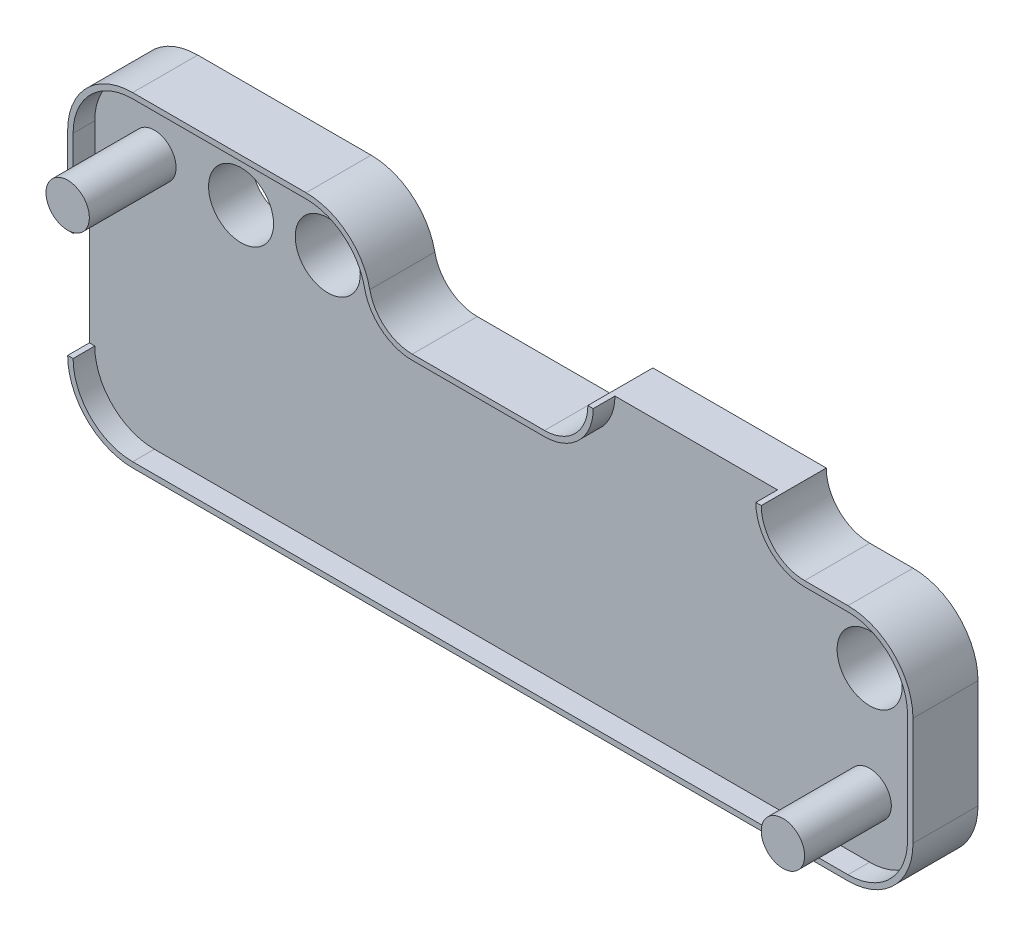
from build123d import *

# Parameters (mm, degrees)
BOSS_EXTRUDE1_DEPTH = 2
FILLET1_R           = 3
FILLET2_R           = 2
SKETCH3_R           = 1.5
CUT_EXTRUDE1_DEPTH  = 2
BOSS_EXTRUDE2_START = 1
BOSS_EXTRUDE2_DEPTH = 1
SKETCH3_5_R         = 1
BOSS_EXTRUDE3_DEPTH = 4


with BuildPart() as part:
    # Sketch1 → Boss-Extrude1 (new body)
    with BuildSketch(Plane.XY):
        Polygon((0, 0), (0, 15), (14, 15), (14, 11), (24, 11), (24, 13), (32, 13), (32, 11), (39, 11), (39, 0), align=None)
    extrude(amount=BOSS_EXTRUDE1_DEPTH)

    # Fillet1
    fillet1_edges = [part.edges().sort_by_distance(p)[0] for p in [
        (0, 0, 1),
        (0, 15, 1),
        (14, 15, 1),
        (39, 11, 1),
        (39, 0, 1),
    ]]
    fillet(fillet1_edges, radius=FILLET1_R)

    # Fillet2
    fillet2_edges = [part.edges().sort_by_distance(p)[0] for p in [
        (32, 11, 1),
        (24, 11, 1),
        (14, 11, 1),
    ]]
    fillet(fillet2_edges, radius=FILLET2_R - 0.0001)  # a hair under: the kernel refuses the full size

    # Sketch3 → Cut-Extrude1 (cut)
    with BuildSketch(Plane.XY.offset(2)):
        with Locations((7, 12)):
            Circle(SKETCH3_R)
        with Locations((11, 12)):
            Circle(SKETCH3_R)
        with Locations((36, 8)):
            Circle(SKETCH3_R)
    extrude(amount=-CUT_EXTRUDE1_DEPTH, mode=Mode.SUBTRACT)

    # Sketch3<4> → Boss-Extrude2 (add)
    with BuildSketch(Plane.XY.offset(2).offset(BOSS_EXTRUDE2_START)):
        with BuildLine():
            Line((0, 8), (0.25, 8))
            Line((0.25, 8), (0.25, 12))
            ThreePointArc((0.25, 12), (1.055456352, 13.944543648), (3, 14.75))
            Line((3, 14.75), (11, 14.75))
            ThreePointArc((11, 14.75), (12.739252713, 14.13014084), (13.694438717, 12.55))
            ThreePointArc((13.694438717, 12.55), (14.475954538, 11.257157494), (15.898979486, 10.75))
            Line((15.898979486, 10.75), (22, 10.75))
            ThreePointArc((22, 10.75), (23.590990258, 11.409009742), (24.25, 13))
            Line((24.25, 13), (24, 13))
            ThreePointArc((24, 13), (23.414213562, 11.585786438), (22, 11))
            Line((22, 11), (15.898979486, 11))
            ThreePointArc((15.898979486, 11), (14.634068421, 11.450806662), (13.939387691, 12.6))
            ThreePointArc((13.939387691, 12.6), (12.897366596, 14.323790008), (11, 15))
            Line((11, 15), (3, 15))
            ThreePointArc((3, 15), (0.878679656, 14.121320344), (0, 12))
            Line((0, 12), (0, 8))
        make_face()
        with BuildLine():
            ThreePointArc((3, 0.25), (1.055456352, 1.055456352), (0.25, 3))
            Line((0.25, 3), (0, 3))
            ThreePointArc((0, 3), (0.878679656, 0.878679656), (3, 0))
            Line((3, 0), (36, 0))
            ThreePointArc((36, 0), (38.121320344, 0.878679656), (39, 3))
            Line((39, 3), (39, 8))
            ThreePointArc((39, 8), (38.121320344, 10.121320344), (36, 11))
            Line((36, 11), (34, 11))
            ThreePointArc((34, 11), (32.585786438, 11.585786438), (32, 13))
            Line((32, 13), (31.75, 13))
            ThreePointArc((31.75, 13), (32.409009742, 11.409009742), (34, 10.75))
            Line((34, 10.75), (36, 10.75))
            ThreePointArc((36, 10.75), (37.944543648, 9.944543648), (38.75, 8))
            Line((38.75, 8), (38.75, 3))
            ThreePointArc((38.75, 3), (37.944543648, 1.055456352), (36, 0.25))
            Line((36, 0.25), (3, 0.25))
        make_face()
    extrude(amount=-BOSS_EXTRUDE2_DEPTH)

    # Sketch3<5> → Boss-Extrude3 (add)
    with BuildSketch(Plane.XY.offset(2)):
        with Locations(Location((3, 12, 0), (0, 0, 180))):
            Circle(SKETCH3_5_R)
        with Locations(Location((36, 3, 0), (0, 0, 180))):
            Circle(SKETCH3_5_R)
    extrude(amount=BOSS_EXTRUDE3_DEPTH)


solid = part.part
